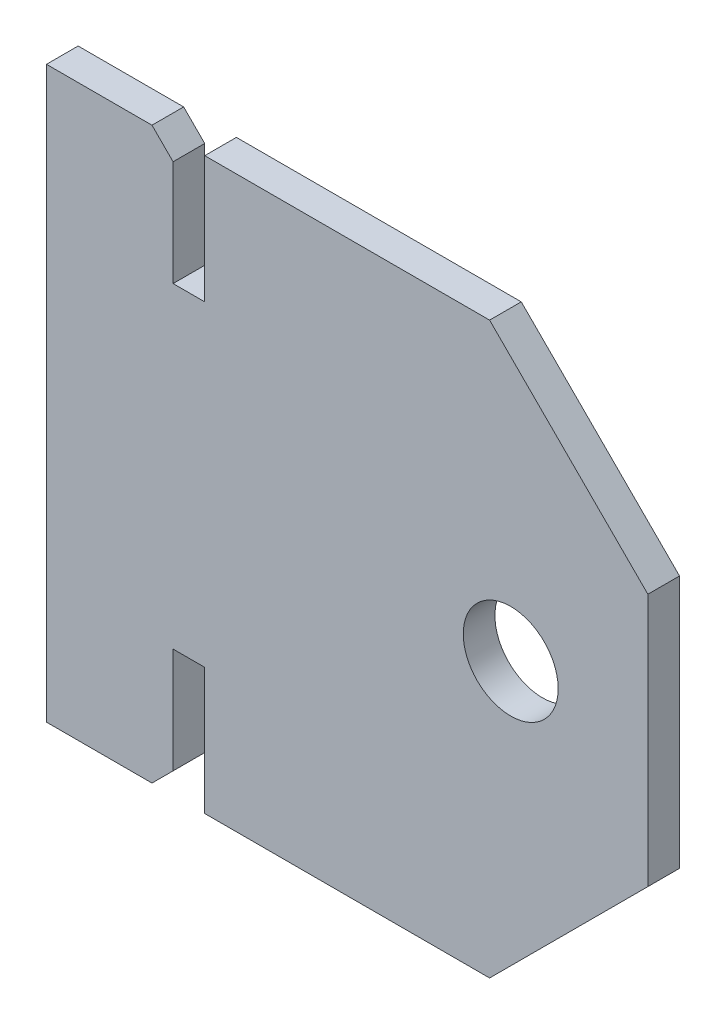
from build123d import *

# Parameters (mm, degrees)
SKETCH1_R          = 4.5
BASE_FLANGE1_DEPTH = 3
CHAMFER2_SIZE      = 15
CHAMFER3_SIZE      = 2


# Sheet-metal steps are written as plain solids
with BuildPart() as part:
    # Sketch1 → Base-Flange1 (new body)
    with BuildSketch(Plane.XY):
        Polygon((-5.322794555, 29.058388501), (23.677205445, 29.058388501), (36.677205445, 29.058388501), (36.677205445, -24.941611499), (17.443611724, -24.941611499), (-5.322794555, -24.941611499), (-5.322794555, -12.941611499), (-8.322794555, -12.941611499), (-8.322794555, -24.941611499), (-20.322794555, -24.941611499), (-20.322794555, 29.058388501), (-8.322794555, 29.058388501), (-8.322794555, 17.058388501), (-5.322794555, 17.058388501), align=None)
        with Locations((23.677205445, 2.058388501)):
            Circle(SKETCH1_R, mode=Mode.SUBTRACT)
    extrude(amount=-BASE_FLANGE1_DEPTH)

    # Chamfer2
    chamfer2_edges = [part.edges().sort_by_distance(p)[0] for p in [
        (36.677205445, 29.058388501, -1.5),
        (36.677205445, -24.941611499, -1.5),
    ]]
    chamfer(chamfer2_edges, length=CHAMFER2_SIZE)

    # Chamfer3
    chamfer3_edges = [part.edges().sort_by_distance(p)[0] for p in [
        (-8.322794555, -24.941611499, -1.5),
        (-8.322794555, 29.058388501, -1.5),
    ]]
    chamfer(chamfer3_edges, length=CHAMFER3_SIZE)


solid = part.part
